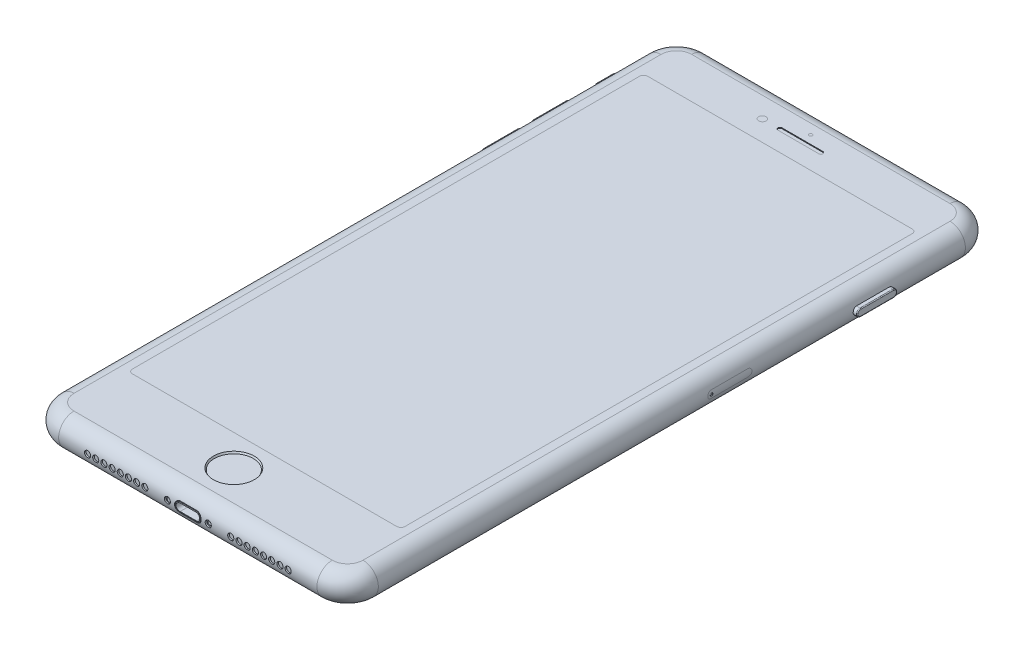
from build123d import *

# Parameters (mm, degrees)
BOSS_EXTRU_1_DEPTH           = 7.5
CONG_2_R                     = 3.75
BOSS_EXTRU_2_DEPTH           = 2
BOSS_EXTRU_2_TAPER           = 30
ESQUISSE3_R                  = 0.5
ENL_V_MAT_EXTRU_1_DEPTH      = 0.5
ESQUISSE6_R                  = 5
ENL_V_MAT_EXTRU_2_DEPTH      = 0.4
ENL_V_MAT_EXTRU_2_DRAFT      = -30
ENL_V_MAT_EXTRU_3_DEPTH      = 0.2
ESQUISSE8_R                  = 0.75
ENL_V_MAT_EXTRU_4_DEPTH      = 0.4
ENL_V_MAT_EXTRU_5_DEPTH      = 4.2
TROU_TARAUD_M1_2X0_251_D     = 0.95
TROU_TARAUD_M1_2X0_251_DEPTH = 1.214591206
TROU_TARAUD_M1_2X0_251_TIP   = 0.285408794
ENL_V_MAT_EXTRU_6_DEPTH      = 1.2
BOSS_EXTRU_3_START           = -0.95
BOSS_EXTRU_3_DEPTH           = 2.15
BOSS_EXTRU_5_START           = 77.990398223
BOSS_EXTRU_5_DEPTH           = 1.059601777
CONG_4_R                     = 0.2
ENL_V_START                  = 78.1
ESQUISSE20_R                 = 0.35
ENL_V_MAT_EXTRU_7_DEPTH      = 0.2


# Read off the part's stored shape, not the designer's step: Boss.-Extru.3, Boss.-Extru.5
with BuildPart() as part:
    # Esquisse1 → Boss.-Extru.1 (new body)
    with BuildSketch(Plane(origin=(0, 0, 0), x_dir=(1, 0, 0), z_dir=(0, 1, 0))):
        with BuildLine():
            Line((7.5, 0), (70.6, 0))
            ThreePointArc((70.6, 0), (75.903300859, 2.196699141), (78.1, 7.5))
            Line((78.1, 7.5), (78.1, 150.9))
            ThreePointArc((78.1, 150.9), (75.903300859, 156.203300859), (70.6, 158.4))
            Line((70.6, 158.4), (7.5, 158.4))
            ThreePointArc((7.5, 158.4), (2.196699141, 156.203300859), (0, 150.9))
            Line((0, 150.9), (0, 7.5))
            ThreePointArc((0, 7.5), (2.196699141, 2.196699141), (7.5, 0))
        make_face()
    extrude(amount=BOSS_EXTRU_1_DEPTH)

    # Congé2
    cong_2_edges = [part.edges().sort_by_distance(p)[0] for p in [
        (39.05, 0, -158.4),
        (75.903300859, 0, -156.203300859),
        (78.1, 0, -79.2),
        (75.903300859, 0, -2.196699141),
        (39.05, 7.5, -158.4),
        (2.196699141, 7.5, -156.203300859),
        (0, 7.5, -79.2),
        (2.196699141, 7.5, -2.196699141),
        (39.05, 7.5, 0),
        (39.05, 0, 0),
        (78.1, 7.5, -79.2),
        (0, 0, -79.2),
    ]]
    fillet(cong_2_edges, radius=CONG_2_R - 0.0001)  # a hair under: the kernel refuses the full size

    # Esquisse2 → Boss.-Extru.2 (add)
    with BuildSketch(Plane.XZ):
        with BuildLine():
            ThreePointArc((64.35, -149.4), (69.1, -144.65), (64.35, -139.9))
            Line((64.35, -139.9), (54.35, -139.9))
            ThreePointArc((54.35, -139.9), (49.6, -144.65), (54.35, -149.4))
            Line((54.35, -149.4), (64.35, -149.4))
        make_face()
    extrude(amount=BOSS_EXTRU_2_DEPTH, taper=BOSS_EXTRU_2_TAPER)

    # Esquisse3 → Enlèv. mat.-Extru.1 (cut)
    with BuildSketch(Plane.XZ):
        with Locations(Location((46.85, -144.65, 0), (0, 0, 270))):
            Circle(ESQUISSE3_R)
    extrude(amount=-ENL_V_MAT_EXTRU_1_DEPTH, mode=Mode.SUBTRACT)


with BuildPart() as enl_v_mat_extru_2_tool:
    # Esquisse6 → Enlèv. mat.-Extru.2 (with draft: the straight prism first)
    with BuildSketch(Plane(origin=(0, 7.5, 0), x_dir=(1, 0, 0), z_dir=(0, 1, 0))):
        with Locations((39.05, 11.25)):
            Circle(ESQUISSE6_R)
    extrude(amount=-ENL_V_MAT_EXTRU_2_DEPTH)
    # Enlèv. mat.-Extru.2: the draft: its side faces are tilted about the plane it starts from
    enl_v_mat_extru_2_sides = [enl_v_mat_extru_2_tool.faces().sort_by_distance(p)[0] for p in [
        (34.05, 7.3, -11.25),
    ]]
    draft(enl_v_mat_extru_2_sides, Plane(origin=(0, 7.5, 0), x_dir=(1, 0, 0), z_dir=(0, 1, 0)), ENL_V_MAT_EXTRU_2_DRAFT)


with BuildPart() as part_1:
    add(part.part)

    # Enlèv. mat.-Extru.2: cut by enl_v_mat_extru_2_tool
    add(enl_v_mat_extru_2_tool.part, mode=Mode.SUBTRACT)

    # Esquisse7 → Enlèv. mat.-Extru.3 (cut)
    with BuildSketch(Plane(origin=(0, 7.5, 0), x_dir=(1, 0, 0), z_dir=(0, 1, 0))):
        with BuildLine():
            Line((34.05, 150.15), (44.05, 150.15))
            ThreePointArc((44.05, 150.15), (44.55, 149.65), (44.05, 149.15))
            Line((44.05, 149.15), (34.05, 149.15))
            ThreePointArc((34.05, 149.15), (33.55, 149.65), (34.05, 150.15))
        make_face()
    extrude(amount=-ENL_V_MAT_EXTRU_3_DEPTH, mode=Mode.SUBTRACT)

    # Esquisse8 → Enlèv. mat.-Extru.4 (cut)
    # profile 1 of 20: a face of its own
    with BuildSketch(Plane.XY):
        with Locations((14.55, 3.75)):
            Circle(ESQUISSE8_R)
    # profile 2 of 20: a face of its own
    with BuildSketch(Plane.XY):
        with Locations((16.55, 3.75)):
            Circle(ESQUISSE8_R)
    # profile 3 of 20: a face of its own
    with BuildSketch(Plane.XY):
        with Locations((18.55, 3.75)):
            Circle(ESQUISSE8_R)
    # profile 4 of 20: a face of its own
    with BuildSketch(Plane.XY):
        with Locations((20.55, 3.75)):
            Circle(ESQUISSE8_R)
    # profile 5 of 20: a face of its own
    with BuildSketch(Plane.XY):
        with Locations((22.55, 3.75)):
            Circle(ESQUISSE8_R)
    # profile 6 of 20: a face of its own
    with BuildSketch(Plane.XY):
        with Locations((24.55, 3.75)):
            Circle(ESQUISSE8_R)
    # profile 7 of 20: a face of its own
    with BuildSketch(Plane.XY):
        with Locations((26.55, 3.75)):
            Circle(ESQUISSE8_R)
    # profile 8 of 20: a face of its own
    with BuildSketch(Plane.XY):
        with Locations((28.55, 3.75)):
            Circle(ESQUISSE8_R)
    # profile 9 of 20: a face of its own
    with BuildSketch(Plane.XY):
        with Locations((34.05, 3.75)):
            Circle(ESQUISSE8_R)
    # profile 10 of 20: a face of its own
    with BuildSketch(Plane.XY):
        with BuildLine():
            Line((37.05, 2.5), (41.05, 2.5))
            ThreePointArc((41.05, 2.5), (42.3, 3.75), (41.05, 5))
            Line((41.05, 5), (37.05, 5))
            ThreePointArc((37.05, 5), (35.8, 3.75), (37.05, 2.5))
        make_face()
        with BuildLine():
            ThreePointArc((37.05, 4.85), (35.95, 3.75), (37.05, 2.65))
            Line((37.05, 2.65), (41.05, 2.65))
            ThreePointArc((41.05, 2.65), (42.15, 3.75), (41.05, 4.85))
            Line((41.05, 4.85), (37.05, 4.85))
        make_face(mode=Mode.SUBTRACT)
    # profile 11 of 20: a face of its own
    with BuildSketch(Plane.XY):
        with BuildLine():
            Line((37.05, 4.65), (41.05, 4.65))
            ThreePointArc((41.05, 4.65), (41.95, 3.75), (41.05, 2.85))
            Line((41.05, 2.85), (37.05, 2.85))
            ThreePointArc((37.05, 2.85), (36.15, 3.75), (37.05, 4.65))
        make_face()
    # profile 12 of 20: a face of its own
    with BuildSketch(Plane.XY):
        with Locations((44.05, 3.75)):
            Circle(ESQUISSE8_R)
    # profile 13 of 20: a face of its own
    with BuildSketch(Plane.XY):
        with Locations((49.55, 3.75)):
            Circle(ESQUISSE8_R)
    # profile 14 of 20: a face of its own
    with BuildSketch(Plane.XY):
        with Locations((51.55, 3.75)):
            Circle(ESQUISSE8_R)
    # profile 15 of 20: a face of its own
    with BuildSketch(Plane.XY):
        with Locations((63.55, 3.75)):
            Circle(ESQUISSE8_R)
    # profile 16 of 20: a face of its own
    with BuildSketch(Plane.XY):
        with Locations((61.55, 3.75)):
            Circle(ESQUISSE8_R)
    # profile 17 of 20: a face of its own
    with BuildSketch(Plane.XY):
        with Locations((59.55, 3.75)):
            Circle(ESQUISSE8_R)
    # profile 18 of 20: a face of its own
    with BuildSketch(Plane.XY):
        with Locations((57.55, 3.75)):
            Circle(ESQUISSE8_R)
    # profile 19 of 20: a face of its own
    with BuildSketch(Plane.XY):
        with Locations((55.55, 3.75)):
            Circle(ESQUISSE8_R)
    # profile 20 of 20: a face of its own
    with BuildSketch(Plane.XY):
        with Locations((53.55, 3.75)):
            Circle(ESQUISSE8_R)
    extrude(amount=-ENL_V_MAT_EXTRU_4_DEPTH, mode=Mode.SUBTRACT)

    # Esquisse9 → Enlèv. mat.-Extru.5 (cut)
    with BuildSketch(Plane.XY.offset(-0.4)):
        with BuildLine():
            Line((41.05, 4.65), (37.05, 4.65))
            ThreePointArc((37.05, 4.65), (36.15, 3.75), (37.05, 2.85))
            Line((37.05, 2.85), (41.05, 2.85))
            ThreePointArc((41.05, 2.85), (41.95, 3.75), (41.05, 4.65))
        make_face()
    extrude(amount=-ENL_V_MAT_EXTRU_5_DEPTH, mode=Mode.SUBTRACT)

    # Trou taraudé M1.2x0.251
    with Locations(Plane.XY.offset(-0.4)):
        with Locations((34.05, 3.75), (44.05, 3.75)):
            Hole(TROU_TARAUD_M1_2X0_251_D / 2, depth=TROU_TARAUD_M1_2X0_251_DEPTH)
            with Locations((0, 0, -(TROU_TARAUD_M1_2X0_251_DEPTH + TROU_TARAUD_M1_2X0_251_TIP / 2))):  # 118° drill point
                Cone(0, TROU_TARAUD_M1_2X0_251_D / 2, TROU_TARAUD_M1_2X0_251_TIP, mode=Mode.SUBTRACT)

    # Esquisse17 → Enlèv. mat.-Extru.6 (cut)
    with BuildSketch(Plane(origin=(0, 0, 0), x_dir=(0, 0, -1), z_dir=(1, 0, 0))):
        with BuildLine():
            Line((143.95, 2.85), (139.85, 2.85))
            ThreePointArc((139.85, 2.85), (139.531801948, 2.981801948), (139.4, 3.3))
            Line((139.4, 3.3), (139.4, 4.2))
            ThreePointArc((139.4, 4.2), (139.531801948, 4.518198052), (139.85, 4.65))
            Line((139.85, 4.65), (143.95, 4.65))
            ThreePointArc((143.95, 4.65), (144.268198052, 4.518198052), (144.4, 4.2))
            Line((144.4, 4.2), (144.4, 3.3))
            ThreePointArc((144.4, 3.3), (144.268198052, 2.981801948), (143.95, 2.85))
        make_face()
    extrude(amount=ENL_V_MAT_EXTRU_6_DEPTH, mode=Mode.SUBTRACT)

    # Boss.-Extru.3 outline → Boss.-Extru.3 (add)
    with BuildSketch(Plane.YZ.offset(BOSS_EXTRU_3_START)):
        with BuildLine():
            Line((3.75, -139.85), (3.75, -143.95))
            ThreePointArc((3.75, -143.95), (4.2, -144.4), (4.65, -143.95))
            Line((4.65, -143.95), (4.65, -139.85))
            ThreePointArc((4.65, -139.85), (4.2, -139.4), (3.75, -139.85))
        make_face()
        with BuildLine():
            Line((4.65, -132.4), (4.65, -124.4))
            ThreePointArc((4.65, -124.4), (3.75, -123.5), (2.85, -124.4))
            Line((2.85, -124.4), (2.85, -132.4))
            ThreePointArc((2.85, -132.4), (3.75, -133.3), (4.65, -132.4))
        make_face()
        with BuildLine():
            Line((4.65, -120.4), (4.65, -112.4))
            ThreePointArc((4.65, -112.4), (3.75, -111.5), (2.85, -112.4))
            Line((2.85, -112.4), (2.85, -120.4))
            ThreePointArc((2.85, -120.4), (3.75, -121.3), (4.65, -120.4))
        make_face()
    extrude(amount=BOSS_EXTRU_3_DEPTH)

    # Boss.-Extru.5 outline → Boss.-Extru.5 (add)
    with BuildSketch(Plane.YZ.offset(BOSS_EXTRU_5_START)):
        with BuildLine():
            Line((4.65, -132.4), (4.65, -124.4))
            ThreePointArc((4.65, -124.4), (3.75, -123.5), (2.85, -124.4))
            Line((2.85, -124.4), (2.85, -132.4))
            ThreePointArc((2.85, -132.4), (3.75, -133.3), (4.65, -132.4))
        make_face()
    extrude(amount=BOSS_EXTRU_5_DEPTH)

    # Congé4
    cong_4_edges = [part_1.edges().sort_by_distance(p)[0] for p in [
        (-0.95, 4.2, -144.4),
        (-0.95, 3.75, -141.9),
        (-0.95, 4.2, -139.4),
        (-0.95, 4.65, -141.9),
        (-0.95, 3.75, -133.3),
        (-0.95, 2.85, -128.4),
        (-0.95, 3.75, -123.5),
        (-0.95, 4.65, -128.4),
        (-0.95, 3.75, -121.3),
        (-0.95, 2.85, -116.4),
        (-0.95, 3.75, -111.5),
        (-0.95, 4.65, -116.4),
        (79.05, 3.75, -133.3),
        (79.05, 4.65, -128.4),
        (79.05, 3.75, -123.5),
        (79.05, 2.85, -128.4),
    ]]
    fillet(cong_4_edges, radius=CONG_4_R)

    # Esquisse20 → Enlèv. mat.-Extru.7 (cut)
    with BuildSketch(Plane(origin=(0, 0, 0), x_dir=(0, 0, -1), z_dir=(1, 0, 0)).offset(ENL_V_START)):
        with Locations((88.9, 3.75)):
            Circle(ESQUISSE20_R)
    extrude(amount=-ENL_V_MAT_EXTRU_7_DEPTH, mode=Mode.SUBTRACT)


solid = part_1.part
